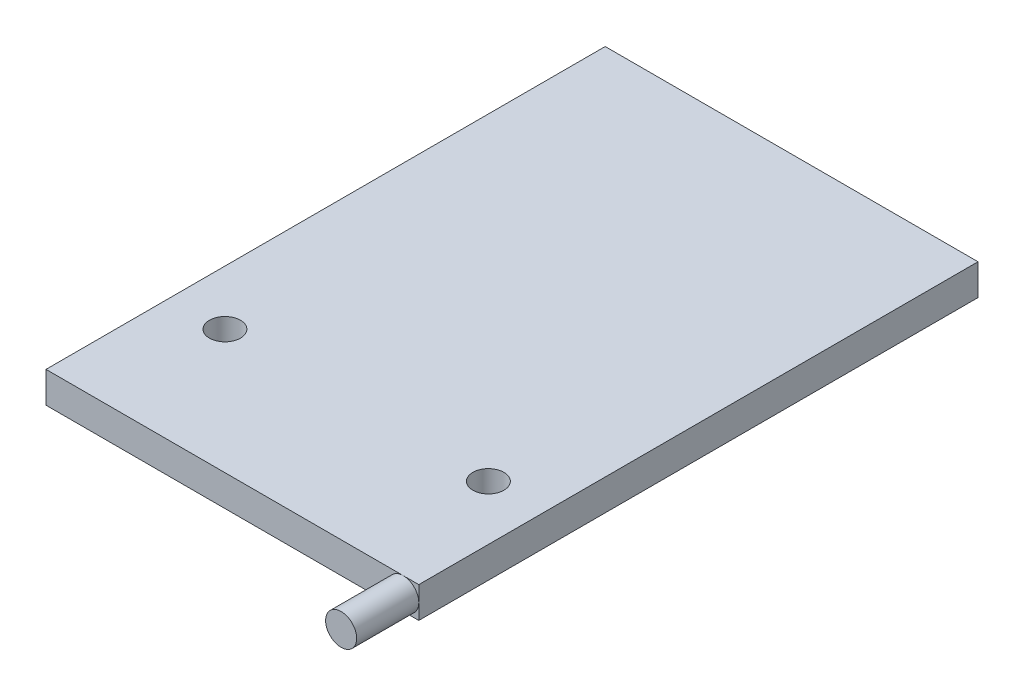
from build123d import *

# Parameters (mm, degrees)
SKETCH1_R           = 2.5
BOSS_EXTRUDE1_DEPTH = 5
SKETCH3_R           = 2.5
BOSS_EXTRUDE2_DEPTH = 10


with BuildPart() as part:
    # Sketch1 → Boss-Extrude1 (new body)
    with BuildSketch(Plane(origin=(0, 0, 0), x_dir=(1, 0, 0), z_dir=(0, 1, 0))):
        Polygon((0, 0), (0, -40), (60, -40), (60, 0), (60, 50), (0, 50), align=None)
        with Locations((51.2, -20)):
            Circle(SKETCH1_R, mode=Mode.SUBTRACT)
        with Locations((8.8, -20)):
            Circle(SKETCH1_R, mode=Mode.SUBTRACT)
    extrude(amount=BOSS_EXTRUDE1_DEPTH)

    # Sketch3 → Boss-Extrude2 (add)
    with BuildSketch(Plane.XY.offset(40)):
        with Locations((57.5, 2.5)):
            Circle(SKETCH3_R)
    extrude(amount=BOSS_EXTRUDE2_DEPTH)


solid = part.part
